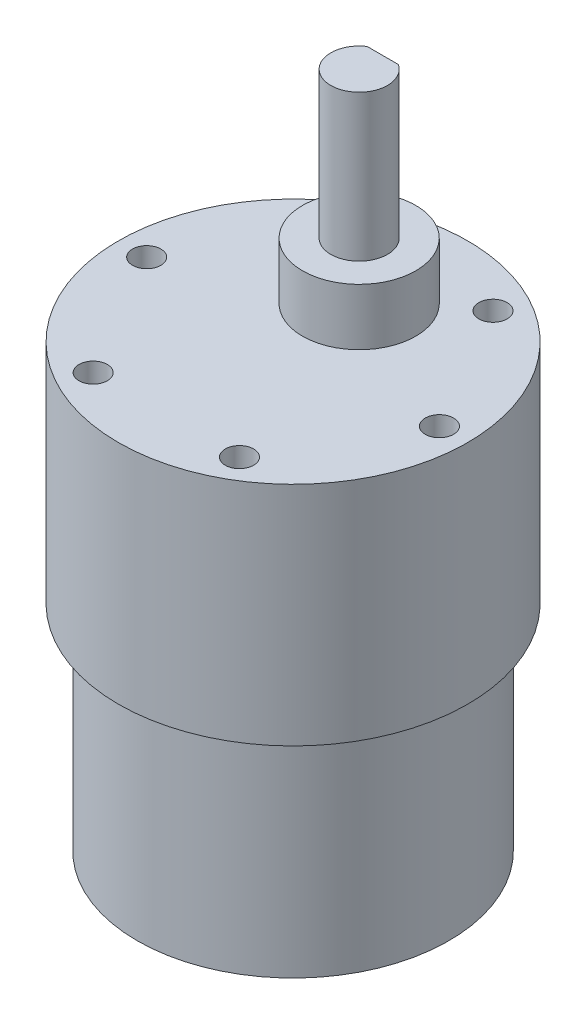
from build123d import *

# Parameters (mm, degrees)
SKETCH_1_R          = 16.5
EXTRUDE_1_DEPTH     = 22.7
SKETCH_2_R          = 18.5
EXTRUDE_2_DEPTH     = 24
SKETCH_3_R          = 6
EXTRUDE_3_DEPTH     = 6
SKETCH_4_R          = 3
EXTRUDE_4_DEPTH     = 15.5
CUT_EXTRUDE_START   = -12
CUT_EXTRUDE_1_DEPTH = 12
SKETCH_6_R          = 1.5
CUT_EXTRUDE_2_DEPTH = 10
SKETCH_7_R          = 5
EXTRUDE_5_DEPTH     = 2
FILLET_1_R          = 0.5


with BuildPart() as part:
    # 草图1 → 凸台-拉伸1 (new body)
    with BuildSketch(Plane(origin=(0, 0, 0), x_dir=(1, 0, 0), z_dir=(0, 1, 0))):
        Circle(SKETCH_1_R)
    extrude(amount=EXTRUDE_1_DEPTH)

    # 草图2 → 凸台-拉伸2 (add)
    with BuildSketch(Plane(origin=(0, 22.7, 0), x_dir=(1, 0, 0), z_dir=(0, 1, 0))):
        Circle(SKETCH_2_R)
    extrude(amount=EXTRUDE_2_DEPTH)

    # 草图3 → 凸台-拉伸3 (add)
    with BuildSketch(Plane(origin=(0, 46.7, 0), x_dir=(1, 0, 0), z_dir=(0, 1, 0))):
        with Locations((0, 7)):
            Circle(SKETCH_3_R)
    extrude(amount=EXTRUDE_3_DEPTH)

    # 草图4 → 凸台-拉伸4 (add)
    with BuildSketch(Plane(origin=(0, 52.7, 0), x_dir=(1, 0, 0), z_dir=(0, 1, 0))):
        with Locations((0, 7)):
            Circle(SKETCH_4_R)
    extrude(amount=EXTRUDE_4_DEPTH)

    # 草图5 → 切除-拉伸1 (cut)
    with BuildSketch(Plane(origin=(0, 68.2, 0), x_dir=(1, 0, 0), z_dir=(0, 1, 0)).offset(CUT_EXTRUDE_START)):
        with BuildLine():
            ThreePointArc((1.658312395, 9.5), (0, 10), (-1.658312395, 9.5))
            Line((-1.658312395, 9.5), (1.658312395, 9.5))
        make_face()
    extrude(amount=CUT_EXTRUDE_1_DEPTH, mode=Mode.SUBTRACT)

    # 草图6 → 切除-拉伸2 (cut)
    with BuildSketch(Plane(origin=(0, 46.7, 0), x_dir=(1, 0, 0), z_dir=(0, 1, 0))):
        with Locations((15.5, 0)):
            Circle(SKETCH_6_R)
        with Locations((7.75, -13.423393759)):
            Circle(SKETCH_6_R)
        with Locations((-7.75, -13.423393759)):
            Circle(SKETCH_6_R)
        with Locations((-15.5, 0)):
            Circle(SKETCH_6_R)
        with Locations((-7.75, 13.423393759)):
            Circle(SKETCH_6_R)
        with Locations((7.75, 13.423393759)):
            Circle(SKETCH_6_R)
    extrude(amount=-CUT_EXTRUDE_2_DEPTH, mode=Mode.SUBTRACT)

    # 草图7 → 凸台-拉伸5 (add)
    with BuildSketch(Plane.XZ):
        Circle(SKETCH_7_R)
    extrude(amount=EXTRUDE_5_DEPTH)

    # 圆角1
    fillet_1_edges = [part.edges().sort_by_distance(p)[0] for p in [
        (-5, -2, 0),
    ]]
    fillet(fillet_1_edges, radius=FILLET_1_R)


solid = part.part
